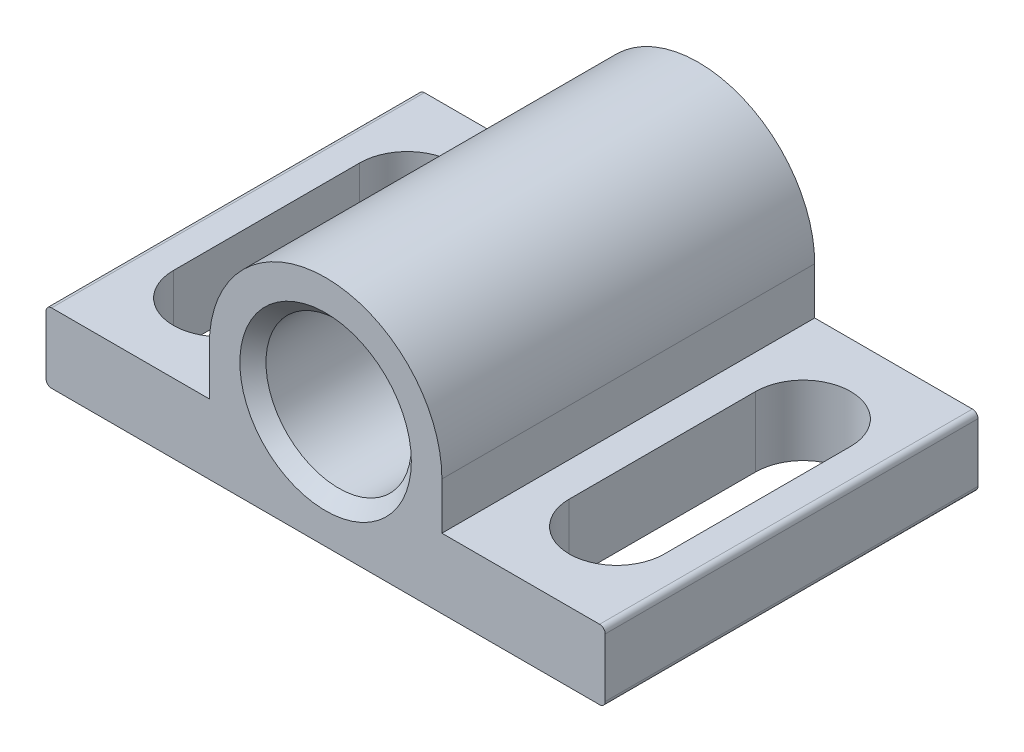
from build123d import *

# Parameters (mm, degrees)
SKETCH1_R                      = 2.5527
BOSS_EXTRUDE1_DEPTH            = 12.7
FILLET1_R                      = 0.381
F_1_2_0_5_DIAMETER_HOLE2_D     = 9.906
F_1_2_0_5_DIAMETER_HOLE2_DEPTH = 19.05
F_1_2_0_5_DIAMETER_HOLE2_TIP   = 5.697774721
CHAMFER2_SIZE                  = 0.889
CUT_EXTRUDE1_DEPTH             = 9.906


with BuildPart() as part:
    # Sketch1 → Boss-Extrude1 (new, symmetric)
    with BuildSketch(Plane.XY):
        with BuildLine():
            Line((-19.05, -2.3749), (19.05, -2.3749))
            Line((19.05, -2.3749), (19.05, 2.3749))
            Line((19.05, 2.3749), (7.9248, 2.3749))
            Line((7.9248, 2.3749), (7.9248, 5.5753))
            ThreePointArc((7.9248, 5.5753), (0, 13.5001), (-7.9248, 5.5753))
            Line((-7.9248, 5.5753), (-7.9248, 2.3749))
            Line((-7.9248, 2.3749), (-19.05, 2.3749))
            Line((-19.05, 2.3749), (-19.05, -2.3749))
        make_face()
        with Locations((0, 5.5753)):
            Circle(SKETCH1_R, mode=Mode.SUBTRACT)
    extrude(amount=BOSS_EXTRUDE1_DEPTH, both=True)

    # Fillet1
    fillet1_edges = [part.edges().sort_by_distance(p)[0] for p in [
        (19.05, 2.3749, 0),
        (-19.05, -2.3749, 0),
        (-19.05, 2.3749, 0),
        (19.05, -2.3749, 0),
    ]]
    fillet(fillet1_edges, radius=FILLET1_R)

    # 1/2 (0.5) Diameter Hole2
    with Locations(Plane.XY.offset(12.7)):
        with Locations((0, 5.5753)):
            Hole(F_1_2_0_5_DIAMETER_HOLE2_D / 2, depth=F_1_2_0_5_DIAMETER_HOLE2_DEPTH)
            with Locations((0, 0, -(F_1_2_0_5_DIAMETER_HOLE2_DEPTH + F_1_2_0_5_DIAMETER_HOLE2_TIP / 2))):  # 82° drill point
                Cone(0, F_1_2_0_5_DIAMETER_HOLE2_D / 2, F_1_2_0_5_DIAMETER_HOLE2_TIP, mode=Mode.SUBTRACT)

    # Chamfer2
    chamfer2_edges = [part.edges().sort_by_distance(p)[0] for p in [
        (4.953, 5.5753, 12.7),
    ]]
    chamfer(chamfer2_edges, length=CHAMFER2_SIZE)

    # Sketch9 → Cut-Extrude1 (cut)
    with BuildSketch(Plane(origin=(0, 2.3749, 0), x_dir=(1, 0, 0), z_dir=(0, 1, 0))):
        with BuildLine():
            Line((16.7259, 6.35), (16.7259, -6.35))
            ThreePointArc((16.7259, -6.35), (13.4874, -9.5885), (10.2489, -6.35))
            Line((10.2489, -6.35), (10.2489, 6.35))
            ThreePointArc((10.2489, 6.35), (13.4874, 9.5885), (16.7259, 6.35))
        make_face()
        with BuildLine():
            Line((-16.7259, 6.35), (-16.7259, -6.35))
            ThreePointArc((-16.7259, -6.35), (-13.4874, -9.5885), (-10.2489, -6.35))
            Line((-10.2489, -6.35), (-10.2489, 6.35))
            ThreePointArc((-10.2489, 6.35), (-13.4874, 9.5885), (-16.7259, 6.35))
        make_face()
    extrude(amount=-CUT_EXTRUDE1_DEPTH, mode=Mode.SUBTRACT)


solid = part.part
